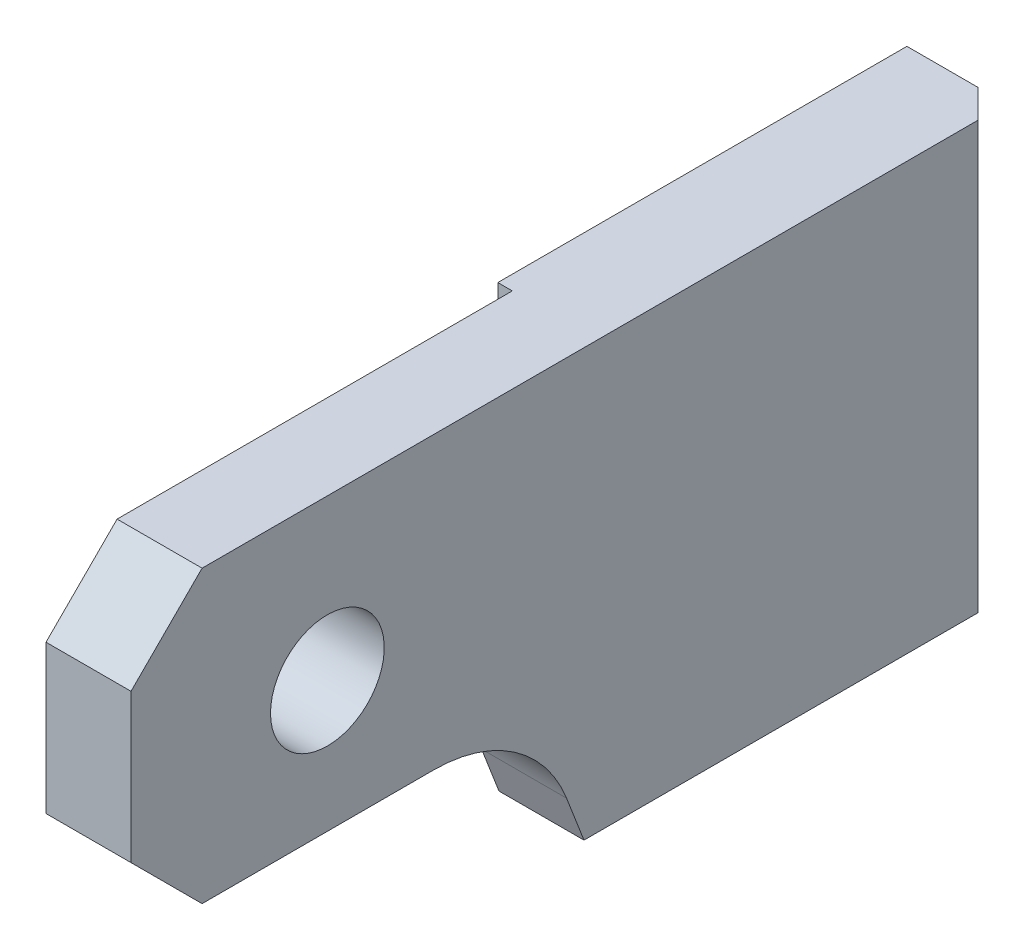
from build123d import *

# Parameters (mm, degrees)
EXTRUDE_1_DEPTH       = 7
FILLET_1_R            = 10
CHAMFER_1_SIZE        = 5
CHAMFER_2_SIZE        = 2
SKETCH_3_R            = 4
CUT_EXTRUDE_2_DEPTH   = 98.811761039
SKETCH_5_W            = 7.308921848
SKETCH_5_H            = 35.296607786
CUT_EXTRUDE_2_2_DEPTH = 98.534926302


with BuildPart() as part:
    # Эскиз1 → Вытянуть1 (new body)
    with BuildSketch(Plane(origin=(0, 0, 0), x_dir=(0, 0, -1), z_dir=(1, 0, 0))):
        Polygon((62.822655934, -30.891323454), (59.120013374, -21.327683482), (30.956731402, -21.327683482), (30.956731402, -0.888409733), (92.539330922, -0.888409733), (92.539330922, -30.896809382), align=None)
    extrude(amount=-EXTRUDE_1_DEPTH)

    # Скругление1
    fillet_1_edges = [part.edges().sort_by_distance(p)[0] for p in [
        (-3.5, -21.327683482, -59.120013374),
    ]]
    fillet(fillet_1_edges, radius=FILLET_1_R)

    # Фаска1
    chamfer_1_edges = [part.edges().sort_by_distance(p)[0] for p in [
        (-3.5, -0.888409733, -30.956731402),
        (-3.5, -21.327683482, -30.956731402),
    ]]
    chamfer(chamfer_1_edges, length=CHAMFER_1_SIZE)

    # Фаска2
    chamfer_2_edges = [part.edges().sort_by_distance(p)[0] for p in [
        (0, -15.892609557, -92.539330922),
    ]]
    chamfer(chamfer_2_edges, length=CHAMFER_2_SIZE)

    # Эскиз3 → Cut-Extrude 2 (cut, through all)
    with BuildSketch(Plane.ZY.offset(7)):
        with Locations((-44.770273228, -12.131888622)):
            Circle(SKETCH_3_R)
    extrude(amount=-CUT_EXTRUDE_2_DEPTH, mode=Mode.SUBTRACT)

    # Эскиз5 → Cut-Extrude 2 2 (cut, through all)
    with BuildSketch(Plane(origin=(0, -30.879724855, 0.005700636), x_dir=(1, 0, 0), z_dir=(0, -0.9999999829599957, 0.0001846077143906597))):
        with Locations((-9.634460924, -46.111441198)):
            Rectangle(SKETCH_5_W, SKETCH_5_H)
    extrude(amount=-CUT_EXTRUDE_2_2_DEPTH, mode=Mode.SUBTRACT)


solid = part.part
